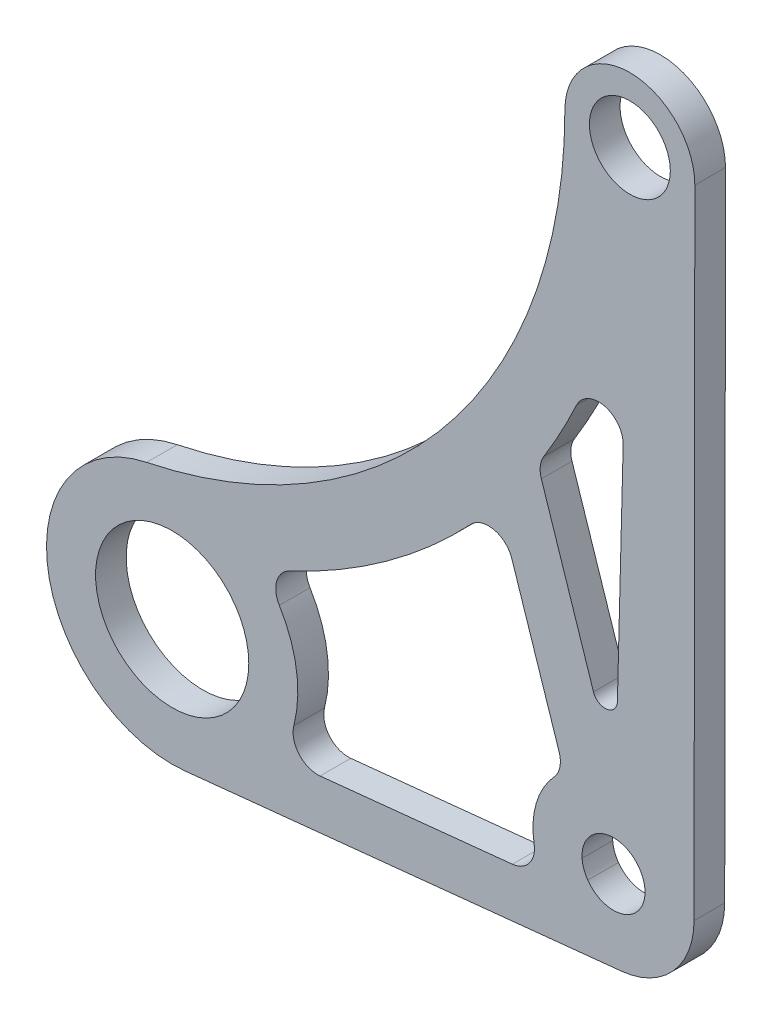
from build123d import *

# Parameters (mm, degrees)
SKETCH2_R           = 7.9375
SKETCH2_R_2         = 4.191
SKETCH2_R_3         = 3.2639
BOSS_EXTRUDE1_DEPTH = 3.175
FILLET1_R           = 2.54
FILLET2_R           = 2.54
FILLET3_R           = 1.27


with BuildPart() as part:
    # Sketch2 → Boss-Extrude1 (new body)
    with BuildSketch(Plane.XY):
        with BuildLine():
            ThreePointArc((-2.650818508, 12.744742739), (-12.863971636, -1.993374025), (1.330677778, -12.949308974))
            Line((1.330677778, -12.949308974), (46.572932, -8.300191215))
            ThreePointArc((46.572932, -8.300191215), (51.910842617, -5.594116097), (54.063893807, -0.010165626))
            Line((54.063893807, -0.010165626), (54.144328338, 66.010086448))
            ThreePointArc((54.144328338, 66.010086448), (47.417433625, 72.74928578), (40.682333333, 66.018287029))
            ThreePointArc((40.682333333, 66.018287029), (28.481097518, 31.682327126), (-2.650818508, 12.744742739))
        make_face()
        Circle(SKETCH2_R, mode=Mode.SUBTRACT)
        with BuildLine():
            ThreePointArc((37.870858113, 32.850760175), (44.087289739, 45.527370695), (47.24074359, 59.289500082))
            Line((47.24074359, 59.289500082), (45.933946154, 8.34115665))
            Line((45.933946154, 8.34115665), (37.870858113, 32.850760175))
        make_face(mode=Mode.SUBTRACT)
        with BuildLine():
            ThreePointArc((9.261094694, 9.148083478), (22.672642931, 16.646008003), (33.800147921, 27.241626483))
            Line((33.800147921, 27.241626483), (40.595697266, 6.584997244))
            ThreePointArc((40.595697266, 6.584997244), (37.546758205, 1.678923993), (38.414831114, -4.031770672))
            Line((38.414831114, -4.031770672), (11.074870198, -6.841239387))
            ThreePointArc((11.074870198, -6.841239387), (12.934545931, 1.467251788), (9.261094694, 9.148083478))
        make_face(mode=Mode.SUBTRACT)
        with Locations((47.413333333, 66.018287029)):
            Circle(SKETCH2_R_2, mode=Mode.SUBTRACT)
        with Locations((45.72, 0)):
            Circle(SKETCH2_R_3, mode=Mode.SUBTRACT)
    extrude(amount=BOSS_EXTRUDE1_DEPTH)

    # Fillet1
    fillet1_edges = [part.edges().sort_by_distance(p)[0] for p in [
        (9.261094694, 9.148083478, 1.5875),
        (11.074870198, -6.841239387, 1.5875),
        (38.414831114, -4.031770672, 1.5875),
        (47.24074359, 59.289500082, 1.5875),
    ]]
    fillet(fillet1_edges, radius=FILLET1_R)

    # Fillet2
    fillet2_edges = [part.edges().sort_by_distance(p)[0] for p in [
        (40.595697266, 6.584997244, 1.5875),
        (37.870858113, 32.850760175, 1.5875),
        (33.800147921, 27.241626483, 1.5875),
    ]]
    fillet(fillet2_edges, radius=FILLET2_R)

    # Fillet3
    fillet3_edges = [part.edges().sort_by_distance(p)[0] for p in [
        (45.933946154, 8.34115665, 1.5875),
    ]]
    fillet(fillet3_edges, radius=FILLET3_R)


solid = part.part
